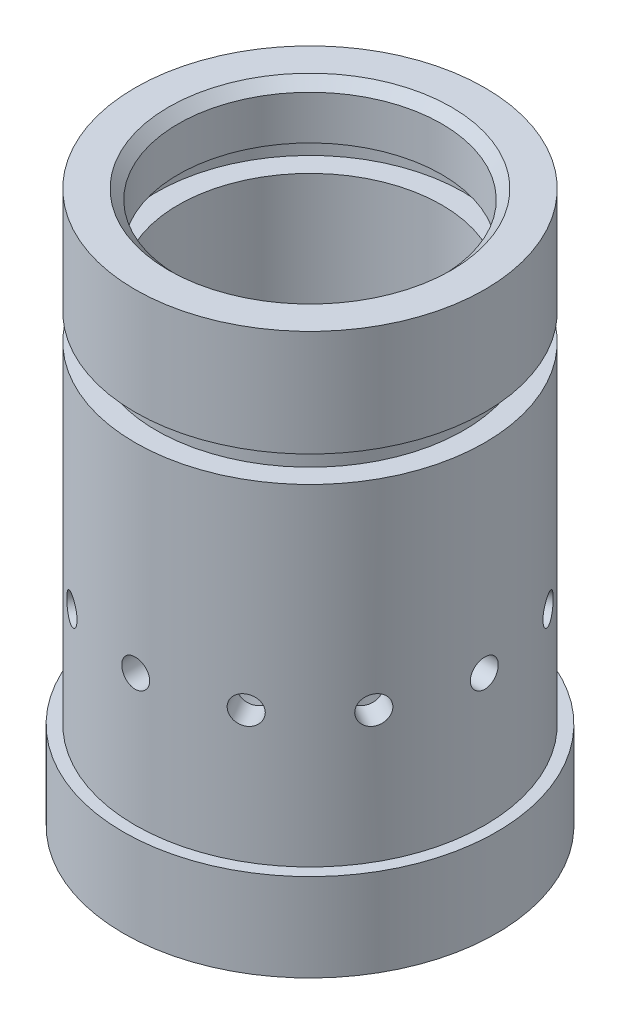
from build123d import *

# Parameters (mm, degrees)
CIRPATTERN1_COUNT = 12


with BuildPart() as part:
    # Sketch1 → Revolve1 (revolve)
    with BuildSketch(Plane.XY):
        Polygon((19.05, -26.176053449), (19.05, -57.672053449), (15.875, -57.672053449), (25.7175, -94.404763523), (26.9875, -94.404763523), (26.9875, -81.704763523), (25.2857, -81.704763523), (25.2857, -33.796053449), (22.225, -33.796053449), (22.225, -29.986053449), (25.2857, -29.986053449), (25.2857, -14.619053449), (20.447, -14.619053449), (19.05, -16.016053449), (19.05, -22.366053449), (22.225, -22.366053449), (22.225, -26.176053449), align=None)
    revolve(axis=Axis((0, 0, 0), (0, 1, 0)))

    # Sketch3 → #10-32 Tapped Hole1 (revolve, cut)
    with BuildSketch(Plane(origin=(0, -62.654763523, -25.2857), x_dir=(0, 1, 0), z_dir=(1, 0, 0))):
        Polygon((0, 0), (0, 4.166057072), (2.0193, 3.81), (2.0193, 0), align=None)
    f_10_32_tapped_hole1 = revolve(axis=Axis((0, -62.654763523, -31.6357), (0, 0, 1)), mode=Mode.SUBTRACT)

    # CirPattern1: #10-32 Tapped Hole1 ×12 about axis
    cirpattern1_axis = Axis((0, 0, 0), (0, -1, 0))
    for i in range(1, CIRPATTERN1_COUNT):
        add(f_10_32_tapped_hole1.rotate(cirpattern1_axis, i * 360 / CIRPATTERN1_COUNT), mode=Mode.SUBTRACT)


solid = part.part
